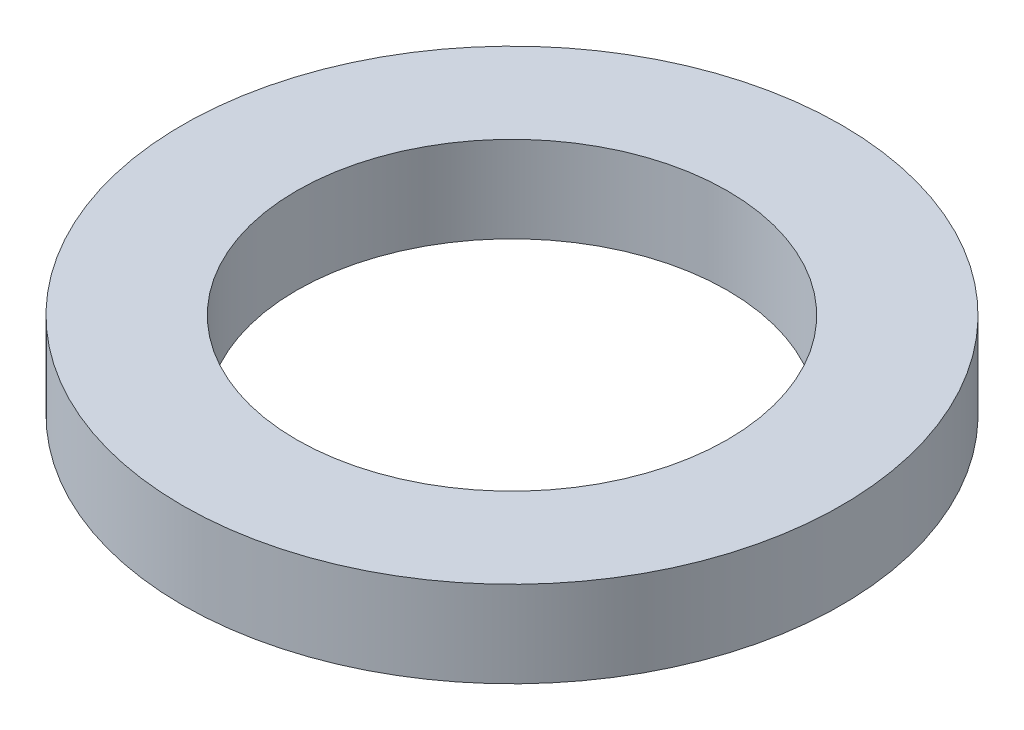
from build123d import *

# Parameters (mm, degrees)
SKETCH1_R           = 65
BOSS_EXTRUDE1_DEPTH = 17
SKETCH2_R           = 42.5
CUT_EXTRUDE1_DEPTH  = 94.482618705


with BuildPart() as part:
    # Sketch1 → Boss-Extrude1 (new body)
    with BuildSketch(Plane(origin=(0, 0, 0), x_dir=(1, 0, 0), z_dir=(0, 1, 0))):
        Circle(SKETCH1_R)
    extrude(amount=BOSS_EXTRUDE1_DEPTH)

    # Sketch2 → Cut-Extrude1 (cut, through all)
    with BuildSketch(Plane(origin=(0, 0, 0), x_dir=(1, 0, 0), z_dir=(0, 1, 0))):
        Circle(SKETCH2_R)
    extrude(amount=CUT_EXTRUDE1_DEPTH, mode=Mode.SUBTRACT)


solid = part.part
